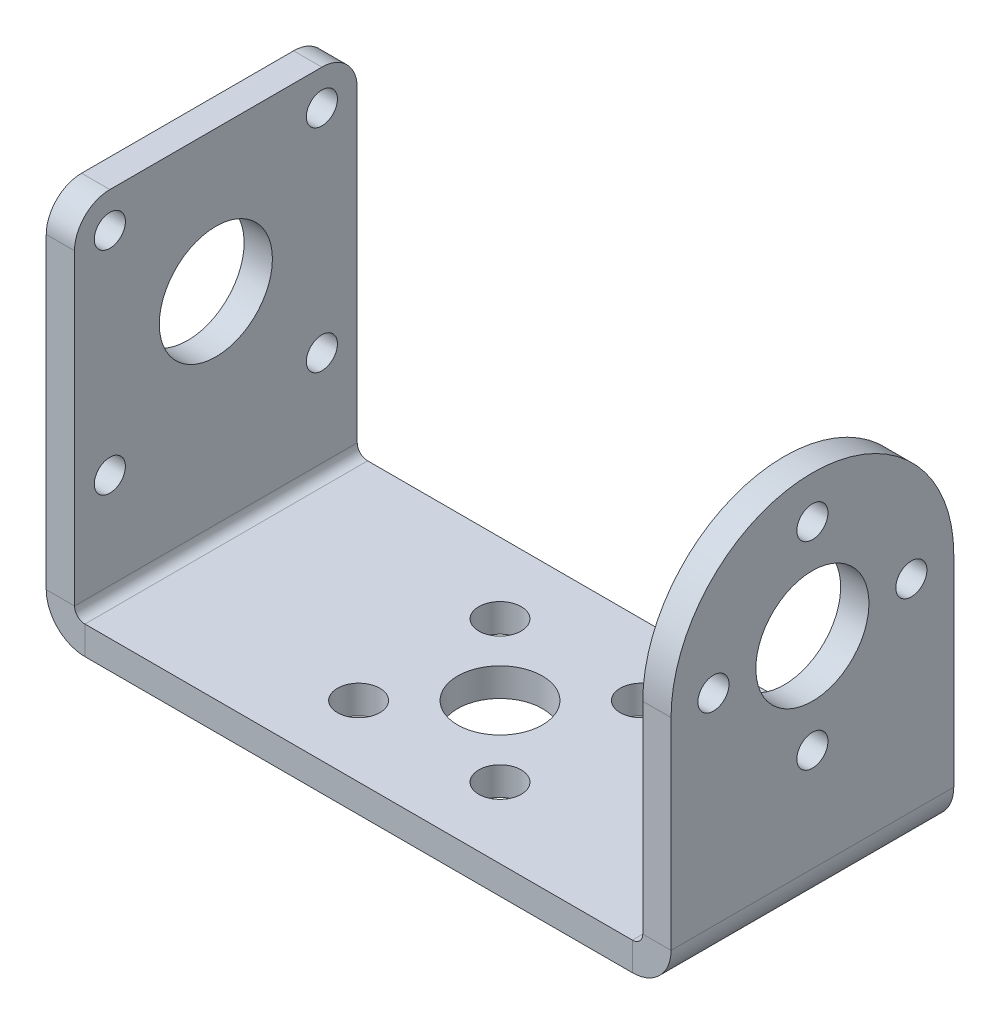
from build123d import *

# Parameters (mm, degrees)
SKETCH_1_W                         = 44.2
SKETCH_1_H                         = 20
SM_BASE_FLANGE_1_DEPTH             = 2
SM_EDGE_FLANGE_1_STRIP_W           = 9.4732
SM_EDGE_FLANGE_1_STRIP_H           = 2
SM_EDGE_FLANGE_1_STRIP_CUT_DEPTH   = 20
SM_EDGE_FLANGE_1_STRIP_2_W         = 9.4732
SM_EDGE_FLANGE_1_STRIP_2_H         = 2
SM_EDGE_FLANGE_1_STRIP_CUT_2_DEPTH = 20
SM_EDGE_FLANGE_1_DEPTH             = 20
SM_EDGE_FLANGE_1_BEND_DEPTH        = 20
CUT_EXTRUDE_1_REACH                = 53.756
SKETCH_14_R                        = 4
SKETCH_14_R_2                      = 1.1
CUT_EXTRUDE_2_REACH                = 53.756
SKETCH_15_R                        = 4
SKETCH_15_R_2                      = 1.1
FILLET_4_R                         = 2.5
FILLET_5_R                         = 2.5
CUT_EXTRUDE_3_REACH                = 38.296
SKETCH_16_R                        = 3
SKETCH_16_R_2                      = 1.5


# Sheet-metal steps are written as plain solids
with BuildPart() as part:
    # Sketch 1 → 基体-法兰1 (new body)
    with BuildSketch(Plane(origin=(0, 0, 0), x_dir=(1, 0, 0), z_dir=(0, 1, 0))):
        Rectangle(SKETCH_1_W, SKETCH_1_H)
    extrude(amount=-SM_BASE_FLANGE_1_DEPTH)

    # 边线-法兰1 strip (across the edge) → 边线-法兰1 strip cut (cut)
    with BuildSketch(Plane(origin=(-22.1, 0, -10), x_dir=(1, 0, 0), z_dir=(0, 0, 1))):
        with Locations((-2, -1)):
            Rectangle(SM_EDGE_FLANGE_1_STRIP_W, SM_EDGE_FLANGE_1_STRIP_H)
    extrude(amount=SM_EDGE_FLANGE_1_STRIP_CUT_DEPTH, mode=Mode.SUBTRACT)

    # 边线-法兰1 strip 2 (across the edge) → 边线-法兰1 strip cut 2 (cut)
    with BuildSketch(Plane(origin=(22.1, 0, 10), x_dir=(-1, 0, 0), z_dir=(0, 0, -1))):
        with Locations((-2, -1)):
            Rectangle(SM_EDGE_FLANGE_1_STRIP_2_W, SM_EDGE_FLANGE_1_STRIP_2_H)
    extrude(amount=SM_EDGE_FLANGE_1_STRIP_CUT_2_DEPTH, mode=Mode.SUBTRACT)

    # 边线-法兰1 section (across the edge) → 边线-法兰1 (add)
    with BuildSketch(Plane(origin=(-22.1, 0, -10), x_dir=(1, 0, 0), z_dir=(0, 0, 1))):
        with BuildLine():
            Line((0, 0.7366), (0, 25))
            Line((0, 25), (2, 25))
            Line((2, 25), (2, 0.7366))
            ThreePointArc((2, 0.7366), (2.215745145, 0.215745145), (2.7366, 0))
            Line((2.7366, 0), (2.7366, -2))
            ThreePointArc((2.7366, -2), (0.801531583, -1.198468417), (0, 0.7366))
        make_face()
    extrude(amount=SM_EDGE_FLANGE_1_DEPTH)

    # 边线-法兰1 section 2 (across the edge) → 边线-法兰1 bend (add)
    with BuildSketch(Plane(origin=(22.1, 0, 10), x_dir=(-1, 0, 0), z_dir=(0, 0, -1))):
        with BuildLine():
            Line((0, 0.7366), (0, 25))
            Line((0, 25), (2, 25))
            Line((2, 25), (2, 0.7366))
            ThreePointArc((2, 0.7366), (2.215745145, 0.215745145), (2.7366, 0))
            Line((2.7366, 0), (2.7366, -2))
            ThreePointArc((2.7366, -2), (0.801531583, -1.198468417), (0, 0.7366))
        make_face()
    extrude(amount=SM_EDGE_FLANGE_1_BEND_DEPTH)

    # 草图14 → 切除-拉伸1 (cut, up to next)
    with BuildSketch(Plane(origin=(22.1, 0, 0), x_dir=(0, 0, -1), z_dir=(1, 0, 0)), mode=Mode.PRIVATE) as cut_extrude_1_sk1:
        with BuildLine():
            ThreePointArc((-10, 15), (-7.071067812, 22.071067812), (0, 25))
            Line((0, 25), (-10, 25))
            Line((-10, 25), (-10, 15))
        make_face()
    cut_extrude_1_tool1 = extrude(cut_extrude_1_sk1.sketch, amount=-CUT_EXTRUDE_1_REACH, mode=Mode.PRIVATE) & part.part
    # 草图14 → 切除-拉伸1 (cut, up to next)
    with BuildSketch(Plane(origin=(22.1, 0, 0), x_dir=(0, 0, -1), z_dir=(1, 0, 0)), mode=Mode.PRIVATE) as cut_extrude_1_sk2:
        with BuildLine():
            ThreePointArc((0, 25), (7.071067812, 22.071067812), (10, 15))
            Line((10, 15), (10, 25))
            Line((10, 25), (0, 25))
        make_face()
    cut_extrude_1_tool2 = extrude(cut_extrude_1_sk2.sketch, amount=-CUT_EXTRUDE_1_REACH, mode=Mode.PRIVATE) & part.part
    # 草图14 → 切除-拉伸1 (cut, up to next)
    with BuildSketch(Plane(origin=(22.1, 0, 0), x_dir=(0, 0, -1), z_dir=(1, 0, 0)), mode=Mode.PRIVATE) as cut_extrude_1_sk3:
        with Locations(Location((0, 15, 0), (0, 0, 90))):
            Circle(SKETCH_14_R)
    cut_extrude_1_tool3 = extrude(cut_extrude_1_sk3.sketch, amount=-CUT_EXTRUDE_1_REACH, mode=Mode.PRIVATE) & part.part
    # 草图14 → 切除-拉伸1 (cut, up to next)
    with BuildSketch(Plane(origin=(22.1, 0, 0), x_dir=(0, 0, -1), z_dir=(1, 0, 0)), mode=Mode.PRIVATE) as cut_extrude_1_sk4:
        with Locations(Location((-7, 15, 0), (0, 0, 90))):
            Circle(SKETCH_14_R_2)
    cut_extrude_1_tool4 = extrude(cut_extrude_1_sk4.sketch, amount=-CUT_EXTRUDE_1_REACH, mode=Mode.PRIVATE) & part.part
    # 草图14 → 切除-拉伸1 (cut, up to next)
    with BuildSketch(Plane(origin=(22.1, 0, 0), x_dir=(0, 0, -1), z_dir=(1, 0, 0)), mode=Mode.PRIVATE) as cut_extrude_1_sk5:
        with Locations(Location((0, 22, 0), (0, 0, 90))):
            Circle(SKETCH_14_R_2)
    cut_extrude_1_tool5 = extrude(cut_extrude_1_sk5.sketch, amount=-CUT_EXTRUDE_1_REACH, mode=Mode.PRIVATE) & part.part
    # 草图14 → 切除-拉伸1 (cut, up to next)
    with BuildSketch(Plane(origin=(22.1, 0, 0), x_dir=(0, 0, -1), z_dir=(1, 0, 0)), mode=Mode.PRIVATE) as cut_extrude_1_sk6:
        with Locations(Location((7, 15, 0), (0, 0, 90))):
            Circle(SKETCH_14_R_2)
    cut_extrude_1_tool6 = extrude(cut_extrude_1_sk6.sketch, amount=-CUT_EXTRUDE_1_REACH, mode=Mode.PRIVATE) & part.part
    # 草图14 → 切除-拉伸1 (cut, up to next)
    with BuildSketch(Plane(origin=(22.1, 0, 0), x_dir=(0, 0, -1), z_dir=(1, 0, 0)), mode=Mode.PRIVATE) as cut_extrude_1_sk7:
        with Locations(Location((0, 8, 0), (0, 0, 90))):
            Circle(SKETCH_14_R_2)
    cut_extrude_1_tool7 = extrude(cut_extrude_1_sk7.sketch, amount=-CUT_EXTRUDE_1_REACH, mode=Mode.PRIVATE) & part.part
    add(cut_extrude_1_tool1.solids().sort_by_distance((22.1, 22.766321, 7.766321))[0], mode=Mode.SUBTRACT)
    add(cut_extrude_1_tool2.solids().sort_by_distance((22.1, 22.766321, -7.766321))[0], mode=Mode.SUBTRACT)
    add(cut_extrude_1_tool3.solids().sort_by_distance((22.1, 15, 0))[0], mode=Mode.SUBTRACT)
    add(cut_extrude_1_tool4.solids().sort_by_distance((22.1, 15, 7))[0], mode=Mode.SUBTRACT)
    add(cut_extrude_1_tool5.solids().sort_by_distance((22.1, 22, 0))[0], mode=Mode.SUBTRACT)
    add(cut_extrude_1_tool6.solids().sort_by_distance((22.1, 15, -7))[0], mode=Mode.SUBTRACT)
    add(cut_extrude_1_tool7.solids().sort_by_distance((22.1, 8, 0))[0], mode=Mode.SUBTRACT)

    # 草图15 → 切除-拉伸2 (cut, up to next)
    with BuildSketch(Plane.ZY.offset(22.1), mode=Mode.PRIVATE) as cut_extrude_2_sk1:
        with Locations(Location((0, 15, 0), (0, 0, 90))):
            Circle(SKETCH_15_R)
    cut_extrude_2_tool1 = extrude(cut_extrude_2_sk1.sketch, amount=-CUT_EXTRUDE_2_REACH, mode=Mode.PRIVATE) & part.part
    # 草图15 → 切除-拉伸2 (cut, up to next)
    with BuildSketch(Plane.ZY.offset(22.1), mode=Mode.PRIVATE) as cut_extrude_2_sk2:
        with Locations(Location((-7.5, 22.5, 0), (0, 0, 270))):
            Circle(SKETCH_15_R_2)
    cut_extrude_2_tool2 = extrude(cut_extrude_2_sk2.sketch, amount=-CUT_EXTRUDE_2_REACH, mode=Mode.PRIVATE) & part.part
    # 草图15 → 切除-拉伸2 (cut, up to next)
    with BuildSketch(Plane.ZY.offset(22.1), mode=Mode.PRIVATE) as cut_extrude_2_sk3:
        with Locations(Location((-7.5, 7.5, 0), (0, 0, 270))):
            Circle(SKETCH_15_R_2)
    cut_extrude_2_tool3 = extrude(cut_extrude_2_sk3.sketch, amount=-CUT_EXTRUDE_2_REACH, mode=Mode.PRIVATE) & part.part
    # 草图15 → 切除-拉伸2 (cut, up to next)
    with BuildSketch(Plane.ZY.offset(22.1), mode=Mode.PRIVATE) as cut_extrude_2_sk4:
        with Locations(Location((7.5, 7.5, 0), (0, 0, 270))):
            Circle(SKETCH_15_R_2)
    cut_extrude_2_tool4 = extrude(cut_extrude_2_sk4.sketch, amount=-CUT_EXTRUDE_2_REACH, mode=Mode.PRIVATE) & part.part
    # 草图15 → 切除-拉伸2 (cut, up to next)
    with BuildSketch(Plane.ZY.offset(22.1), mode=Mode.PRIVATE) as cut_extrude_2_sk5:
        with Locations(Location((7.5, 22.5, 0), (0, 0, 270))):
            Circle(SKETCH_15_R_2)
    cut_extrude_2_tool5 = extrude(cut_extrude_2_sk5.sketch, amount=-CUT_EXTRUDE_2_REACH, mode=Mode.PRIVATE) & part.part
    add(cut_extrude_2_tool1.solids().sort_by_distance((-22.1, 15, 0))[0], mode=Mode.SUBTRACT)
    add(cut_extrude_2_tool2.solids().sort_by_distance((-22.1, 22.5, -7.5))[0], mode=Mode.SUBTRACT)
    add(cut_extrude_2_tool3.solids().sort_by_distance((-22.1, 7.5, -7.5))[0], mode=Mode.SUBTRACT)
    add(cut_extrude_2_tool4.solids().sort_by_distance((-22.1, 7.5, 7.5))[0], mode=Mode.SUBTRACT)
    add(cut_extrude_2_tool5.solids().sort_by_distance((-22.1, 22.5, 7.5))[0], mode=Mode.SUBTRACT)

    # 圆角4
    fillet_4_edges = [part.edges().sort_by_distance(p)[0] for p in [
        (-21.1, 25, -10),
    ]]
    fillet(fillet_4_edges, radius=FILLET_4_R)

    # 圆角5
    fillet_5_edges = [part.edges().sort_by_distance(p)[0] for p in [
        (-21.1, 25, 10),
    ]]
    fillet(fillet_5_edges, radius=FILLET_5_R)

    # 草图16 → 切除-拉伸3 (cut, up to next)
    with BuildSketch(Plane.XZ.offset(2), mode=Mode.PRIVATE) as cut_extrude_3_sk1:
        with Locations(Location((0, 0, 0), (0, 0, 270))):
            Circle(SKETCH_16_R)
    cut_extrude_3_tool1 = extrude(cut_extrude_3_sk1.sketch, amount=-CUT_EXTRUDE_3_REACH, mode=Mode.PRIVATE) & part.part
    # 草图16 → 切除-拉伸3 (cut, up to next)
    with BuildSketch(Plane.XZ.offset(2), mode=Mode.PRIVATE) as cut_extrude_3_sk2:
        with Locations(Location((-5, 5, 0), (0, 0, 270))):
            Circle(SKETCH_16_R_2)
    cut_extrude_3_tool2 = extrude(cut_extrude_3_sk2.sketch, amount=-CUT_EXTRUDE_3_REACH, mode=Mode.PRIVATE) & part.part
    # 草图16 → 切除-拉伸3 (cut, up to next)
    with BuildSketch(Plane.XZ.offset(2), mode=Mode.PRIVATE) as cut_extrude_3_sk3:
        with Locations(Location((5, 5, 0), (0, 0, 270))):
            Circle(SKETCH_16_R_2)
    cut_extrude_3_tool3 = extrude(cut_extrude_3_sk3.sketch, amount=-CUT_EXTRUDE_3_REACH, mode=Mode.PRIVATE) & part.part
    # 草图16 → 切除-拉伸3 (cut, up to next)
    with BuildSketch(Plane.XZ.offset(2), mode=Mode.PRIVATE) as cut_extrude_3_sk4:
        with Locations(Location((5, -5, 0), (0, 0, 270))):
            Circle(SKETCH_16_R_2)
    cut_extrude_3_tool4 = extrude(cut_extrude_3_sk4.sketch, amount=-CUT_EXTRUDE_3_REACH, mode=Mode.PRIVATE) & part.part
    # 草图16 → 切除-拉伸3 (cut, up to next)
    with BuildSketch(Plane.XZ.offset(2), mode=Mode.PRIVATE) as cut_extrude_3_sk5:
        with Locations(Location((-5, -5, 0), (0, 0, 270))):
            Circle(SKETCH_16_R_2)
    cut_extrude_3_tool5 = extrude(cut_extrude_3_sk5.sketch, amount=-CUT_EXTRUDE_3_REACH, mode=Mode.PRIVATE) & part.part
    add(cut_extrude_3_tool1.solids().sort_by_distance((0, -2, 0))[0], mode=Mode.SUBTRACT)
    add(cut_extrude_3_tool2.solids().sort_by_distance((-5, -2, 5))[0], mode=Mode.SUBTRACT)
    add(cut_extrude_3_tool3.solids().sort_by_distance((5, -2, 5))[0], mode=Mode.SUBTRACT)
    add(cut_extrude_3_tool4.solids().sort_by_distance((5, -2, -5))[0], mode=Mode.SUBTRACT)
    add(cut_extrude_3_tool5.solids().sort_by_distance((-5, -2, -5))[0], mode=Mode.SUBTRACT)


solid = part.part
